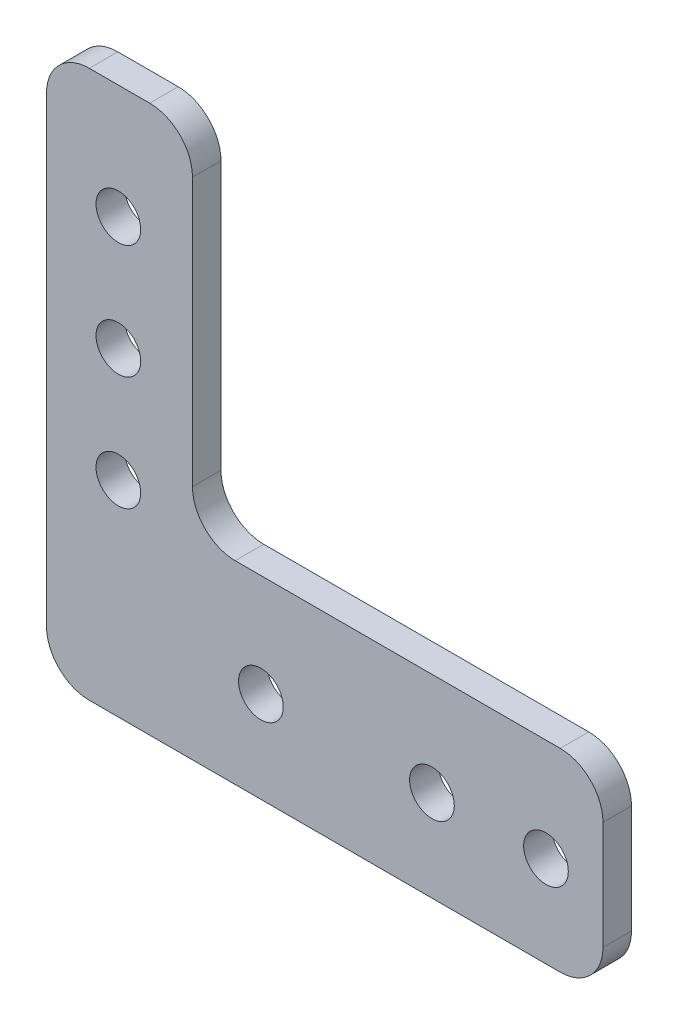
from build123d import *

# Parameters (mm, degrees)
SKETCH1_R           = 2.4892
BOSS_EXTRUDE1_DEPTH = 3.175
FILLET1_R           = 4.7625


with BuildPart() as part:
    # Sketch1 → Boss-Extrude1 (new body)
    with BuildSketch(Plane.XY):
        Polygon((-27.051, 31.75), (-27.051, -29.21), (34.925, -29.21), (34.925, -7.62), (-10.795, -7.62), (-10.795, 31.75), align=None)
        with Locations((-3.175, -19.05)):
            Circle(SKETCH1_R, mode=Mode.SUBTRACT)
        with Locations((-19.05, -6.35)):
            Circle(SKETCH1_R, mode=Mode.SUBTRACT)
        with Locations((15.875, -19.05)):
            Circle(SKETCH1_R, mode=Mode.SUBTRACT)
        with Locations((28.575, -19.05)):
            Circle(SKETCH1_R, mode=Mode.SUBTRACT)
        with Locations((-19.05, 6.35)):
            Circle(SKETCH1_R, mode=Mode.SUBTRACT)
        with Locations((-19.05, 19.05)):
            Circle(SKETCH1_R, mode=Mode.SUBTRACT)
    extrude(amount=BOSS_EXTRUDE1_DEPTH)

    # Fillet1
    fillet1_edges = [part.edges().sort_by_distance(p)[0] for p in [
        (-27.051, 31.75, 1.5875),
        (-10.795, 31.75, 1.5875),
        (-10.795, -7.62, 1.5875),
        (34.925, -7.62, 1.5875),
        (34.925, -29.21, 1.5875),
        (-27.051, -29.21, 1.5875),
    ]]
    fillet(fillet1_edges, radius=FILLET1_R)


solid = part.part
